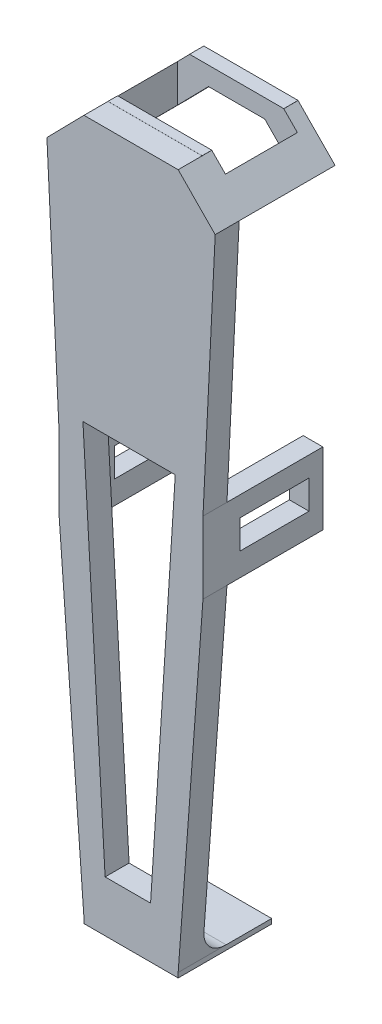
from build123d import *

# Parameters (mm, degrees)
BOSS_EXTRUDE1_DEPTH   = 40
SKETCH1_W             = 8.198494791
SKETCH1_H             = 30
BOSS_EXTRUDE1_2_DEPTH = 40
SKETCH1_W_2           = 7.801505209
BOSS_EXTRUDE1_3_DEPTH = 40
BOSS_EXTRUDE2_DEPTH   = 10
SKETCH3_W             = 39.29
SKETCH3_H             = 39
BOSS_EXTRUDE3_DEPTH   = 2
FILLET1_R             = 10
SKETCH4_W             = 28.841998226
SKETCH4_H             = 12
CUT_EXTRUDE1_DEPTH    = 200
SKETCH5_W             = 50
SKETCH5_H             = 30.008790532
CUT_EXTRUDE2_DEPTH    = 50
CUT_EXTRUDE3_DEPTH    = 30


with BuildPart() as part:
    # Sketch1 → Boss-Extrude1 (new body)
    with BuildSketch(Plane.XY):
        Polygon((-27.787096512, 25.913149565), (-27.787096512, 25.885892475), (-43.235049783, 10.14086318), (-35.355311996, 2.409799691), (-19.880615921, 18.182086076), (3.601216654, 18.182086076), (19.075912729, 2.409799691), (26.955650516, 10.14086318), (11.507697245, 25.885892475), (11.507697245, 25.913149565), align=None)
    extrude(amount=BOSS_EXTRUDE1_DEPTH)



with BuildPart() as body_2:
    # Sketch1 → Boss-Extrude1 2 (new body)
    with BuildSketch(Plane.XY):
        with Locations((17.76105297, -109.086850435)):
            Rectangle(SKETCH1_W, SKETCH1_H)
    extrude(amount=BOSS_EXTRUDE1_2_DEPTH)


with BuildPart() as body_3:
    # Sketch1 → Boss-Extrude1 3 (new body)
    with BuildSketch(Plane.XY):
        with Locations((-34.23894703, -109.086850435)):
            Rectangle(SKETCH1_W_2, SKETCH1_H)
    extrude(amount=BOSS_EXTRUDE1_3_DEPTH)


with BuildPart() as part_1:
    add(part.part)

    add(body_2.part)  # Boss-Extrude2 merges body 2

    add(body_3.part)  # Boss-Extrude2 merges body 3
    # Sketch2 → Boss-Extrude2 (add)
    with BuildSketch(Plane.XY.offset(40)):
        Polygon((-43.235049783, 10.14086318), (-38.139699634, -94.086850435), (-38.139699634, -124.086850435), (-27.787096512, -264.114107525), (11.507697245, -264.114107525), (21.860300366, -124.086850435), (21.860300366, -94.086850435), (26.955650516, 10.14086318), (11.507697245, 25.885892475), (-27.787096512, 25.885892475), align=None)
    extrude(amount=BOSS_EXTRUDE2_DEPTH)

    # Sketch3 → Boss-Extrude3 (add)
    with BuildSketch(Plane.XZ.offset(264.114107525)):
        with Locations((-8.137302755, 30.5)):
            Rectangle(SKETCH3_W, SKETCH3_H)
    extrude(amount=BOSS_EXTRUDE3_DEPTH)

    # Fillet1
    fillet1_edges = [part_1.edges().sort_by_distance(p)[0] for p in [
        (-8.137302755, -264.114107525, 40),
    ]]
    fillet(fillet1_edges, radius=FILLET1_R)

    # Sketch4 → Cut-Extrude1 (cut)
    with BuildSketch(Plane.ZY.offset(38.139699634)):
        with Locations((20.187288549, -108.429522733)):
            Rectangle(SKETCH4_W, SKETCH4_H)
    extrude(amount=-CUT_EXTRUDE1_DEPTH, mode=Mode.SUBTRACT)

    # Sketch5 → Cut-Extrude2 (cut)
    with BuildSketch(Plane(origin=(0, 25.913149565, 0), x_dir=(1, 0, 0), z_dir=(0, 1, 0))):
        with Locations((-7.813085756, -20.959154247)):
            Rectangle(SKETCH5_W, SKETCH5_H)
    extrude(amount=-CUT_EXTRUDE2_DEPTH, mode=Mode.SUBTRACT)

    # Sketch6 → Cut-Extrude3 (cut)
    with BuildSketch(Plane.XY.offset(50)):
        Polygon((-18.962130687, -244.828996869), (0, -244.828996869), (10.296607629, -84.942947042), (-28.220565644, -84.942947042), align=None)
    extrude(amount=-CUT_EXTRUDE3_DEPTH, mode=Mode.SUBTRACT)


solid = part_1.part
